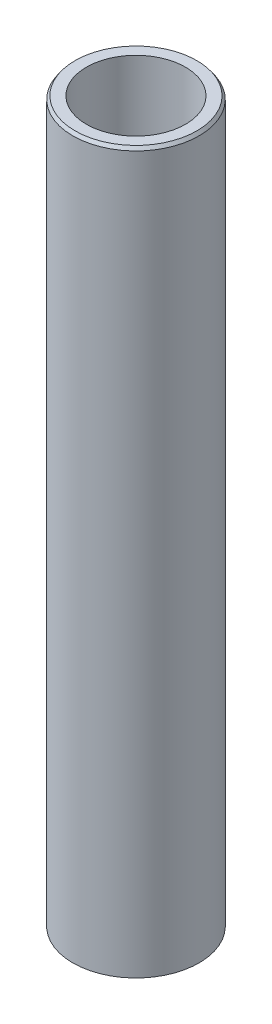
from build123d import *
from OCP.BRepFilletAPI import BRepFilletAPI_MakeChamfer

# Parameters (mm, degrees)
SKETCH1_R           = 52.5
BOSS_EXTRUDE1_DEPTH = 600
SKETCH2_R           = 41.186882703
CUT_EXTRUDE1_DEPTH  = 605.576297914
CHAMFER1_SIZE       = 2.665885706
CHAMFER1_SIZE2      = 1.874151059


with BuildPart() as part:
    # Sketch1 → Boss-Extrude1 (new body)
    with BuildSketch(Plane(origin=(0, 0, 0), x_dir=(1, 0, 0), z_dir=(0, 1, 0))):
        Circle(SKETCH1_R)
    extrude(amount=BOSS_EXTRUDE1_DEPTH)

    # Sketch2 → Cut-Extrude1 (cut, through all)
    with BuildSketch(Plane(origin=(0, 0, 0), x_dir=(1, 0, 0), z_dir=(0, 1, 0))):
        Circle(SKETCH2_R)
    extrude(amount=CUT_EXTRUDE1_DEPTH, mode=Mode.SUBTRACT)

    # Chamfer1: one chamfer whose edges measure the first distance from different faces: ONE call of the kernel's chamfer builder (chamfer() names one face for all edges)
    chamfer1_edges_1 = [part.edges().sort_by_distance(p)[0] for p in [
        (-52.5, 600, 0),
    ]]
    chamfer1_side_1 = [part.faces().sort_by_distance(p)[0] for p in [
        (-52.5, 300, 0),
    ]]
    chamfer1_edges_2 = [part.edges().sort_by_distance(p)[0] for p in [
        (-52.5, 0, 0),
    ]]
    chamfer1_side_2 = [part.faces().sort_by_distance(p)[0] for p in [
        (-51.01507576, 0, 0),
    ]]
    chamfer1 = BRepFilletAPI_MakeChamfer(part.part.solid().wrapped)
    for e in chamfer1_edges_1:
        chamfer1.Add(CHAMFER1_SIZE, CHAMFER1_SIZE2, e.wrapped, chamfer1_side_1[0].wrapped)  # the first distance lies on this face
    for e in chamfer1_edges_2:
        chamfer1.Add(CHAMFER1_SIZE, CHAMFER1_SIZE2, e.wrapped, chamfer1_side_2[0].wrapped)  # the first distance lies on this face
    add(Compound.cast(chamfer1.Shape()), mode=Mode.REPLACE)


solid = part.part
